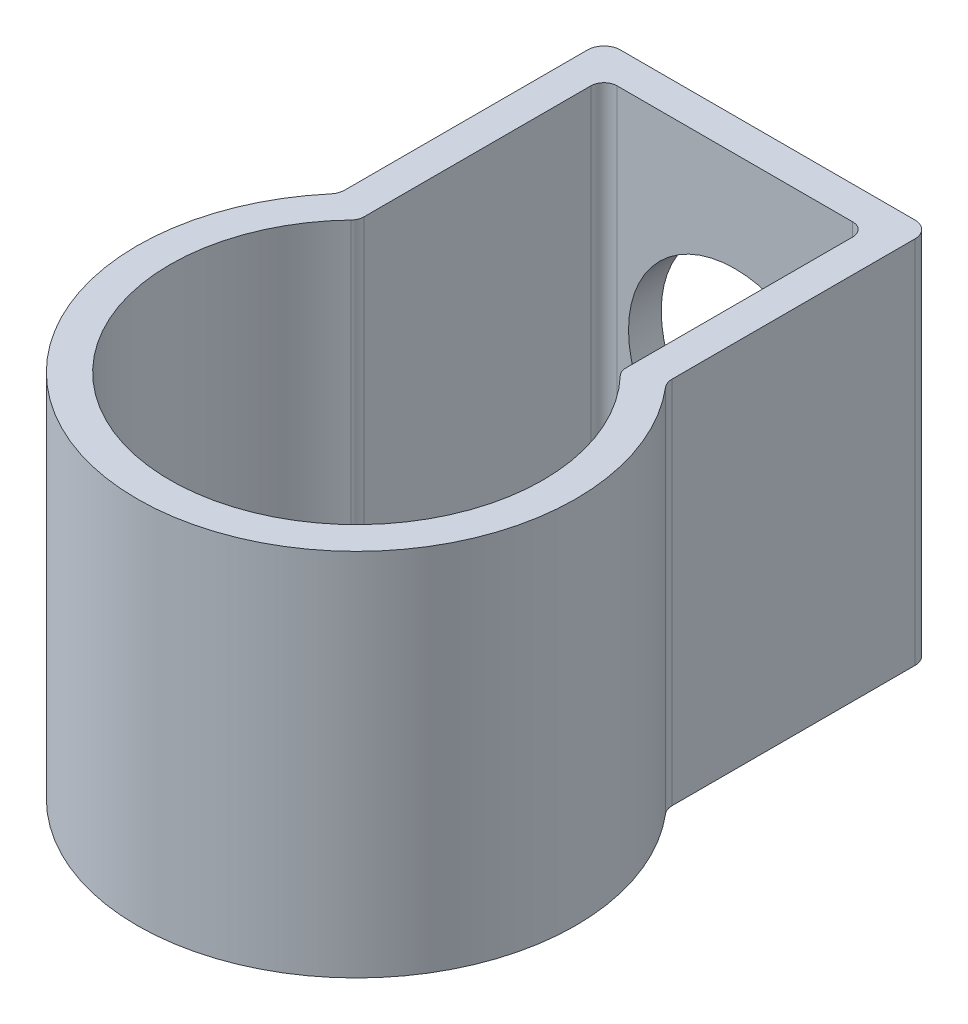
from build123d import *

# Parameters (mm, degrees)
BOSS_EXTRUDE1_DEPTH = 20.574
BOSS_EXTRUDE2_START = 2
BOSS_EXTRUDE2_DEPTH = 2
SKETCH3_R           = 6.5
CUT_EXTRUDE1_DEPTH  = 45.007669834
FILLET1_R           = 1
SKETCH4_W           = 6
SKETCH4_H           = 0.5
BOSS_EXTRUDE3_DEPTH = 0.4
FILLET2_START       = -3
FILLET2_DEPTH       = 2
FILLET2_START_2     = -2
FILLET2_2_DEPTH     = 0.5
FILLET3_R           = 0.8
CHAMFER1_SIZE       = 0.2


with BuildPart() as part:
    # Sketch1 → Boss-Extrude1 (new body)
    with BuildSketch(Plane(origin=(0, 0, 0), x_dir=(1, 0, 0), z_dir=(0, 1, 0))):
        with BuildLine():
            Line((10, 8.919641248), (10, 25.121576202))
            Line((10, 25.121576202), (-10, 25.121576202))
            Line((-10, 25.121576202), (-10, 8.919641248))
            ThreePointArc((-10, 8.919641248), (0, -13.4), (10, 8.919641248))
        make_face()
        with BuildLine():
            Line((-8, 23.121576202), (-8, 8.121576202))
            ThreePointArc((-8, 8.121576202), (0, -11.4), (8, 8.121576202))
            Line((8, 8.121576202), (8, 23.121576202))
            Line((8, 23.121576202), (-8, 23.121576202))
        make_face(mode=Mode.SUBTRACT)
    extrude(amount=BOSS_EXTRUDE1_DEPTH)

    # Sketch2 → Boss-Extrude2 (add)
    with BuildSketch(Plane.XZ.offset(BOSS_EXTRUDE2_START)):
        with BuildLine():
            Line((10, -8.919641248), (10, -25.121576202))
            Line((10, -25.121576202), (-10, -25.121576202))
            Line((-10, -25.121576202), (-10, -8.919641248))
            ThreePointArc((-10, -8.919641248), (0, 13.4), (10, -8.919641248))
        make_face()
    extrude(amount=-BOSS_EXTRUDE2_DEPTH)

    # Sketch3 → Cut-Extrude1 (cut, through all)
    with BuildSketch(Plane.XY.offset(-23.121576202)):
        with Locations((0, 8)):
            Circle(SKETCH3_R)
    extrude(amount=-CUT_EXTRUDE1_DEPTH, mode=Mode.SUBTRACT)

    # Fillet1
    fillet1_edges = [part.edges().sort_by_distance(p)[0] for p in [
        (-10, 9.287, -8.919641248),
        (-10, 9.287, -25.121576202),
        (10, 9.287, -25.121576202),
        (10, 9.287, -8.919641248),
    ]]
    fillet(fillet1_edges, radius=FILLET1_R)

    # Sketch4 → Boss-Extrude3 (add)
    with BuildSketch(Plane(origin=(0, 0, -25.121576202), x_dir=(-1, 0, 0), z_dir=(0, 0, -1))):
        with Locations((0, -1.75)):
            Rectangle(SKETCH4_W, SKETCH4_H)
    extrude(amount=BOSS_EXTRUDE3_DEPTH)

    # Fillet2: read off the stored shape, not the designer's step
    # Fillet2 outline → Fillet2 (cut)
    with BuildSketch(Plane(origin=(0, 0, 0), x_dir=(1, 0, 0), z_dir=(0, 1, 0)).offset(FILLET2_START)):
        with BuildLine():
            ThreePointArc((-3, 25.321576202), (-2.941421356, 25.462997558), (-2.8, 25.521576202))
            Line((-2.8, 25.521576202), (-3, 25.521576202))
            Line((-3, 25.521576202), (-3, 25.321576202))
        make_face()
        with BuildLine():
            Line((3, 25.521576202), (2.8, 25.521576202))
            ThreePointArc((2.8, 25.521576202), (2.941421356, 25.462997558), (3, 25.321576202))
            Line((3, 25.321576202), (3, 25.521576202))
        make_face()
    extrude(amount=FILLET2_DEPTH, mode=Mode.SUBTRACT)

    # Fillet2 2 outline → Fillet2 2 (add)
    with BuildSketch(Plane(origin=(0, 0, 0), x_dir=(1, 0, 0), z_dir=(0, 1, 0)).offset(FILLET2_START_2)):
        with BuildLine():
            Line((-3, 25.121576202), (-3, 25.321576202))
            ThreePointArc((-3, 25.321576202), (-3.058578644, 25.180154845), (-3.2, 25.121576202))
            Line((-3.2, 25.121576202), (-3, 25.121576202))
        make_face()
        with BuildLine():
            ThreePointArc((3.2, 25.121576202), (3.058578644, 25.180154845), (3, 25.321576202))
            Line((3, 25.321576202), (3, 25.121576202))
            Line((3, 25.121576202), (3.2, 25.121576202))
        make_face()
    extrude(amount=FILLET2_2_DEPTH)

    # Fillet3
    fillet3_edges = [part.edges().sort_by_distance(p)[0] for p in [
        (8, 10.287, -23.121576202),
        (-8, 10.287, -23.121576202),
        (-8, 10.287, -8.121576202),
        (8, 10.287, -8.121576202),
    ]]
    fillet(fillet3_edges, radius=FILLET3_R)

    # Chamfer1
    chamfer1_edges = [part.edges().sort_by_distance(p)[0] for p in [
        (8, 0, -15.385714136),
        (0, 0, -23.121576202),
        (-8, 0, -15.385714136),
        (0, 0, 11.4),
        (-7.765685425, 0, -22.887261627),
        (7.765685425, 0, -22.887261627),
        (8.057827734, 0, -8.151221315),
        (-8.057827734, 0, -8.151221315),
    ]]
    chamfer(chamfer1_edges, length=CHAMFER1_SIZE)


solid = part.part
